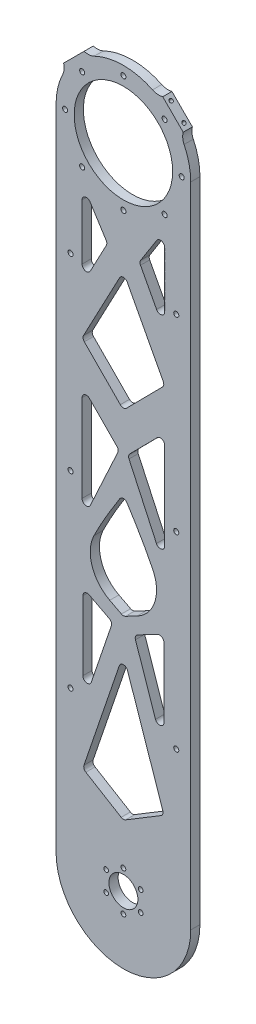
from build123d import *

# Parameters (mm, degrees)
SKETCH2_R                            = 10
SKETCH2_R_2                          = 1.65
BOSS_EXTRUDE1_DEPTH                  = 6.35
CUT_EXTRUDE1_DEPTH                   = 10
FILLET3_R                            = 3
SKETCH5_R                            = 1.75
CUT_EXTRUDE2_DEPTH                   = 549.511460792
SKETCH6_R                            = 26.5
CUT_EXTRUDE3_DEPTH                   = 10
BOSS_EXTRUDE2_START                  = -6.35
BOSS_EXTRUDE2_DEPTH                  = 6.35
TAP_DRILL_FOR_M3X0_5_TAP1_AT_2_COUNT = 2
TAP_DRILL_FOR_M3X0_5_TAP1_AT_2_PITCH = 12
CIRPATTERN2_COUNT                    = 2
CIRPATTERN2_ANGLE                    = 90
CUT_EXTRUDE4_DEPTH                   = 549.511460792
SKETCH11_R                           = 34
CUT_EXTRUDE5_DEPTH                   = 549.511460792
CUT_EXTRUDE6_DEPTH                   = 549.511460792
CUT_EXTRUDE6_DEPTH_BACK              = 549.511460792
SKETCH12_R                           = 1.75
SKETCH13_W                           = 93
SKETCH13_H                           = 53.952458561
CUT_EXTRUDE7_DEPTH                   = 549.511460792
BOSS_EXTRUDE3_REACH                  = 319.131
SKETCH14_W                           = 17.515975695
SKETCH14_H                           = 6.35
BOSS_EXTRUDE4_DEPTH                  = 6.35
SKETCH16_R                           = 1.75
CUT_EXTRUDE8_DEPTH                   = 497.007604239
SKETCH17_R                           = 1.75
BOSS_EXTRUDE5_DEPTH                  = 6.35
BOSS_EXTRUDE6_DEPTH                  = 6.35
M3X0_5_TAPPED_HOLE1_AT_2_COUNT       = 2
M3X0_5_TAPPED_HOLE1_AT_2_PITCH       = 12.5
CIRPATTERN3_COUNT                    = 2
CIRPATTERN3_ANGLE                    = 90
FILLET4_R                            = 10


with BuildPart() as part:
    # Sketch2 → Boss-Extrude1 (new body)
    with BuildSketch(Plane.XY):
        with BuildLine():
            Line((-46.5, 0), (-46.5, 500))
            ThreePointArc((-46.5, 500), (0, 546.5), (46.5, 500))
            Line((46.5, 500), (46.5, 0))
            ThreePointArc((46.5, 0), (0, -46.5), (-46.5, 0))
        make_face()
        Circle(SKETCH2_R, mode=Mode.SUBTRACT)
        with Locations((0, 13.75)):
            Circle(SKETCH2_R_2, mode=Mode.SUBTRACT)
        with Locations((11.907849302, 6.875)):
            Circle(SKETCH2_R_2, mode=Mode.SUBTRACT)
        with Locations((11.907849302, -6.875)):
            Circle(SKETCH2_R_2, mode=Mode.SUBTRACT)
        with Locations((0, -13.75)):
            Circle(SKETCH2_R_2, mode=Mode.SUBTRACT)
        with Locations((-11.907849302, -6.875)):
            Circle(SKETCH2_R_2, mode=Mode.SUBTRACT)
        with Locations((-11.907849302, 6.875)):
            Circle(SKETCH2_R_2, mode=Mode.SUBTRACT)
    extrude(amount=BOSS_EXTRUDE1_DEPTH)

    # Sketch4 → Cut-Extrude1 (cut)
    with BuildSketch(Plane.XY.offset(6.35)):
        Polygon((28.005258112, 59.37595418), (0, 42.411661153), (-28.005258112, 59.37595418), (0, 141.693437584), align=None)
        Polygon((-7.5, 156.905935087), (-28.005258112, 96.633637735), (-28.005258112, 167.582877854), align=None)
        Polygon((28.005258112, 167.582877854), (7.5, 156.905935087), (28.005258112, 96.633637735), align=None)
        with BuildLine():
            Line((0, 164.275138905), (28.550546746, 179.141206521))
            add(Edge.make_bspline(
                [(28.550546746, 179.141206521), (45.32025339, 216.985654627), (19.430092874, 259.790255689), (0, 290.025756679)],
                knots=[0, 0, 0, 0, 1, 1, 1, 1], degree=3))
            add(Edge.make_bspline(
                [(-28.550546746, 179.141206521), (-45.32025339, 216.985654627), (-19.430092874, 259.790255689), (0, 290.025756679)],
                knots=[0, 0, 0, 0, 1, 1, 1, 1], degree=3))
            Line((-28.550546746, 179.141206521), (0, 164.275138905))
        make_face()
        Polygon((28.550546746, 259.58677623), (3, 314.938284003), (28.550546746, 340.793051053), align=None)
        Polygon((-3, 314.938284003), (-28.550546746, 340.793051053), (-28.550546746, 259.58677623), align=None)
        Polygon((0, 423.142843498), (-28.550546746, 369.246205395), (0, 340.355718526), (28.550546746, 369.246205395), align=None)
        Polygon((-28.550546746, 462.095190817), (-28.550546746, 401.290241252), (-11, 434.421497018), align=None)
        Polygon((28.550546746, 401.290241252), (11, 434.421497018), (28.550546746, 462.095190817), align=None)
    extrude(amount=-CUT_EXTRUDE1_DEPTH, mode=Mode.SUBTRACT)

    # Fillet3
    fillet3_edges = [part.edges().sort_by_distance(p)[0] for p in [
        (-11, 434.421497018, 3.175),
        (-28.550546746, 401.290241252, 3.175),
        (28.550546746, 401.290241252, 3.175),
        (11, 434.421497018, 3.175),
        (28.550546746, 462.095190817, 3.175),
        (-28.550546746, 462.095190817, 3.175),
        (0, 423.142843498, 3.175),
        (-28.550546746, 369.246205395, 3.175),
        (28.550546746, 369.246205395, 3.175),
        (0, 340.355718526, 3.175),
        (28.550546746, 340.793051053, 3.175),
        (-28.550546746, 340.793051053, 3.175),
        (-3, 314.938284003, 3.175),
        (3, 314.938284003, 3.175),
        (28.550546746, 259.58677623, 3.175),
        (-28.550546746, 259.58677623, 3.175),
        (28.550546746, 179.141206521, 3.175),
        (0, 290.025756679, 3.175),
        (-28.550546746, 179.141206521, 3.175),
        (0, 164.275138905, 3.175),
        (-28.005258112, 96.633637735, 3.175),
        (28.005258112, 96.633637735, 3.175),
        (7.5, 156.905935087, 3.175),
        (-28.005258112, 167.582877854, 3.175),
        (28.005258112, 167.582877854, 3.175),
        (0, 141.693437584, 3.175),
        (28.005258112, 59.37595418, 3.175),
        (-28.005258112, 59.37595418, 3.175),
        (0, 42.411661153, 3.175),
        (-7.5, 156.905935087, 3.175),
    ]]
    fillet(fillet3_edges, radius=FILLET3_R)

    # Sketch5 → Cut-Extrude2 (cut, through all)
    with BuildSketch(Plane.XY.offset(6.35)):
        with Locations((36.5, 103.175)):
            Circle(SKETCH5_R)
        with Locations(Location((-36.5, 103.175, 0), (0, 0, 180))):
            Circle(SKETCH5_R)
        with Locations(Location((36.5, 259.525, 0), (0, 0, 180))):
            Circle(SKETCH5_R)
        with Locations((-36.5, 259.525)):
            Circle(SKETCH5_R)
        with Locations((36.5, 415.875)):
            Circle(SKETCH5_R)
        with Locations(Location((-36.5, 415.875, 0), (0, 0, 180))):
            Circle(SKETCH5_R)
    extrude(amount=-CUT_EXTRUDE2_DEPTH, mode=Mode.SUBTRACT)

    # Sketch6 → Cut-Extrude3 (cut)
    with BuildSketch(Plane.XY.offset(6.35)):
        with Locations((0, 500)):
            Circle(SKETCH6_R)
    extrude(amount=-CUT_EXTRUDE3_DEPTH, mode=Mode.SUBTRACT)

    # Sketch7 → Boss-Extrude2 (add)
    with BuildSketch(Plane.XY.offset(6.35).offset(BOSS_EXTRUDE2_START)):
        with BuildLine():
            Line((44.110383395, 529.968247771), (29.968247771, 544.110383395))
            ThreePointArc((29.968247771, 544.110383395), (23.286397782, 542.399293624), (16.474718596, 543.483717035))
            ThreePointArc((16.474718596, 543.483717035), (32.880465325, 532.880465325), (43.483717035, 516.474718596))
            ThreePointArc((43.483717035, 516.474718596), (42.399293624, 523.286397782), (44.110383395, 529.968247771))
        make_face()
    boss_extrude2 = extrude(amount=BOSS_EXTRUDE2_DEPTH)

    # Sketch9 → Tap Drill for M3x0.5 Tap1 (revolve, cut)
    with BuildSketch(Plane(origin=(32.796674896, 541.28195627, 3.175), x_dir=(-0.7071067811865481, 0.7071067811865469, 0), z_dir=(0, 0, 1))):
        Polygon((0, 0), (0, 5.751075774), (1.25, 5), (1.25, 0), align=None)
    tap_drill_for_m3x0_5_tap1 = revolve(axis=Axis((37.286802956, 545.772084331, 3.175), (-0.7071067811865468, -0.7071067811865482, 0)), mode=Mode.SUBTRACT)

    # Tap Drill for M3x0.5 Tap1 at 2: Tap Drill for M3x0.5 Tap1 ×2
    with Locations(*[Vector(0.7071067811865482, -0.7071067811865468, 0) * (i * TAP_DRILL_FOR_M3X0_5_TAP1_AT_2_PITCH) for i in range(1, TAP_DRILL_FOR_M3X0_5_TAP1_AT_2_COUNT)]):
        add(tap_drill_for_m3x0_5_tap1, mode=Mode.SUBTRACT)

    # CirPattern2: Boss-Extrude2, Tap Drill for M3x0.5 Tap1 ×2 about axis
    cirpattern2_axis = Axis((0, 500, 0), (0, 0, 1))
    add([boss_extrude2.rotate(cirpattern2_axis, i * CIRPATTERN2_ANGLE / (CIRPATTERN2_COUNT - 1)) for i in range(1, CIRPATTERN2_COUNT)])
    add([tap_drill_for_m3x0_5_tap1.rotate(cirpattern2_axis, i * CIRPATTERN2_ANGLE / (CIRPATTERN2_COUNT - 1)) for i in range(1, CIRPATTERN2_COUNT)], mode=Mode.SUBTRACT)

    # CirPattern2 copy 1 sketch → CirPattern2 copy 1 (revolve, cut)
    with BuildSketch(Plane(origin=(-32.796674896, 541.28195627, 3.175), x_dir=(-0.7071067811865445, -0.7071067811865506, 0), z_dir=(0, 0, 1))):
        Polygon((0, 0), (0, 5.751075774), (1.25, 5), (1.25, 0), align=None)
    revolve(axis=Axis((-37.286802956, 545.772084331, 3.175), (0.7071067811865507, -0.7071067811865444, 0)), mode=Mode.SUBTRACT)

    # Sketch10 → Cut-Extrude4 (cut, through all)
    with BuildSketch(Plane.XY.offset(6.35)):
        with BuildLine():
            Line((-43.483717035, 516.474718596), (-63.483717035, 516.474718596))
            ThreePointArc((-63.483717035, 516.474718596), (0, 565.586573942), (63.483717035, 516.474718596))
            Line((63.483717035, 516.474718596), (43.483717035, 516.474718596))
            ThreePointArc((43.483717035, 516.474718596), (0, 546.5), (-43.483717035, 516.474718596))
        make_face()
    extrude(amount=-CUT_EXTRUDE4_DEPTH, mode=Mode.SUBTRACT)

    # Sketch11 → Cut-Extrude5 (cut, through all)
    with BuildSketch(Plane.XY.offset(6.35)):
        with Locations((0, 500)):
            Circle(SKETCH11_R)
    extrude(amount=-CUT_EXTRUDE5_DEPTH, mode=Mode.SUBTRACT)

    # Sketch12 → Cut-Extrude6 (cut, two sides: drawn at the far end of the back side and taken through both)
    with BuildSketch(Plane.XY.offset(6.35).offset(-CUT_EXTRUDE6_DEPTH_BACK)):
        with Locations((0, 540.25)):
            Circle(SKETCH12_R)
        with Locations((28.461047943, 528.461047943)):
            Circle(SKETCH12_R)
        with Locations((40.25, 500)):
            Circle(SKETCH12_R)
        with Locations((28.461047943, 471.538952057)):
            Circle(SKETCH12_R)
        with Locations((0, 459.75)):
            Circle(SKETCH12_R)
        with Locations((-28.461047943, 471.538952057)):
            Circle(SKETCH12_R)
        with Locations((-40.25, 500)):
            Circle(SKETCH12_R)
        with Locations((-28.461047943, 528.461047943)):
            Circle(SKETCH12_R)
    extrude(amount=CUT_EXTRUDE6_DEPTH + CUT_EXTRUDE6_DEPTH_BACK, mode=Mode.SUBTRACT)

    # Sketch13 → Cut-Extrude7 (cut, through all)
    with BuildSketch(Plane(origin=(0, 0, 0), x_dir=(-1, 0, 0), z_dir=(0, 0, -1))):
        with Locations((0, 207.119171895)):
            Rectangle(SKETCH13_W, SKETCH13_H)
    extrude(amount=-CUT_EXTRUDE7_DEPTH, mode=Mode.SUBTRACT)


with BuildPart() as cut_extrude7_piece_1:
    # of the separate pieces the step leaves, piece 1, a body of its own (cut_extrude7_pieces)
    add(part.part.solids().sort_by_distance((46.5, 500, 0))[0])


with BuildPart() as cut_extrude7_piece_2:
    # of the separate pieces the step leaves, piece 2, a body of its own (cut_extrude7_pieces)
    add(part.part.solids().sort_by_distance((46.5, 180.142942614, 0))[0])


with BuildPart() as cut_extrude7_piece_1_1:
    # Body-Move/Copy1: moved
    add(cut_extrude7_piece_1.part.moved(Location((0, -52.7176888, 0))))

    # Boss-Extrude3: up to this face of the body (flat: up to its plane)
    boss_extrude3_end = Plane(cut_extrude7_piece_1_1.part.faces().sort_by_distance((37.742012152, 181.377712375, 3.175))[0])
    # Sketch14 → Boss-Extrude3 (add, up to the picked face)
    with BuildSketch(Plane(origin=(0, 180.142942614, 0), x_dir=(1, 0, 0), z_dir=(0, 1, 0)), mode=Mode.PRIVATE) as boss_extrude3_sk1:
        with Locations((-37.742012153, -3.175)):
            Rectangle(SKETCH14_W, SKETCH14_H)
    boss_extrude3_tool1 = split(extrude(boss_extrude3_sk1.sketch, amount=BOSS_EXTRUDE3_REACH, mode=Mode.PRIVATE), bisect_by=boss_extrude3_end, keep=Keep.BOTH, mode=Mode.PRIVATE)
    # Sketch14 → Boss-Extrude3 (add, up to the picked face)
    with BuildSketch(Plane(origin=(0, 180.142942614, 0), x_dir=(1, 0, 0), z_dir=(0, 1, 0)), mode=Mode.PRIVATE) as boss_extrude3_sk2:
        with Locations((37.742012153, -3.175)):
            Rectangle(SKETCH14_W, SKETCH14_H)
    boss_extrude3_tool2 = split(extrude(boss_extrude3_sk2.sketch, amount=BOSS_EXTRUDE3_REACH, mode=Mode.PRIVATE), bisect_by=boss_extrude3_end, keep=Keep.BOTH, mode=Mode.PRIVATE)

    add(cut_extrude7_piece_2.part)  # Boss-Extrude3 merges Cut-Extrude7 piece 2
    add(boss_extrude3_tool1.solids().sort_by(Axis((-37.742012, 180.142943, 3.175), (0, 1, 0)))[0])
    add(boss_extrude3_tool2.solids().sort_by(Axis((37.742012, 180.142943, 3.175), (0, 1, 0)))[0])

    # Sketch15 → Boss-Extrude4 (add)
    with BuildSketch(Plane(origin=(0, 0, 0), x_dir=(-1, 0, 0), z_dir=(0, 0, -1))):
        with BuildLine():
            Line((28.984024305, 181.377712375), (28.984024305, 180.142942614))
            ThreePointArc((28.984024305, 180.142942614), (28.425309599, 179.275911344), (27.605954054, 178.649363792))
            Line((27.605954054, 178.649363792), (9.43812576, 169.189504186))
            ThreePointArc((9.43812576, 169.189504186), (21.644913421, 183.565600372), (20.334408511, 202.379435266))
            add(Edge.make_bspline(
                [(28.984024305, 181.377712375), (26.665870811, 188.528361062), (23.678798122, 195.56600215), (20.334408511, 202.379435266)],
                knots=[0.471090389, 0.471090389, 0.471090389, 0.471090389, 0.656207947, 0.656207947, 0.656207947, 0.656207947], degree=3))
        make_face()
        with BuildLine():
            Line((-9.43812576, 169.189504186), (-27.605954054, 178.649363792))
            ThreePointArc((-27.605954054, 178.649363792), (-28.425309599, 179.275911344), (-28.984024305, 180.142942614))
            Line((-28.984024305, 180.142942614), (-28.984024304, 181.377712375))
            add(Edge.make_bspline(
                [(-28.984024304, 181.377712375), (-26.665870811, 188.528361062), (-23.678798122, 195.56600215), (-20.334408511, 202.379435266)],
                knots=[0.471090389, 0.471090389, 0.471090389, 0.471090389, 0.656207947, 0.656207947, 0.656207947, 0.656207947], degree=3))
            ThreePointArc((-20.334408511, 202.379435266), (-21.644913421, 183.565600372), (-9.43812576, 169.189504186))
        make_face()
    extrude(amount=-BOSS_EXTRUDE4_DEPTH)

    # Sketch16 → Cut-Extrude8 (cut, through all)
    with BuildSketch(Plane(origin=(0, 0, 0), x_dir=(-1, 0, 0), z_dir=(0, 0, -1))):
        with Locations((36.5, 233.1661556)):
            Circle(SKETCH16_R)
        with Locations((-36.5, 233.1661556)):
            Circle(SKETCH16_R)
    extrude(amount=-CUT_EXTRUDE8_DEPTH, mode=Mode.SUBTRACT)

    # Sketch17 → Boss-Extrude5 (add)
    with BuildSketch(Plane(origin=(0, 0, 0), x_dir=(-1, 0, 0), z_dir=(0, 0, -1))):
        with Locations((36.5, 206.8073112)):
            Circle(SKETCH17_R)
        with Locations((-36.5, 206.8073112)):
            Circle(SKETCH17_R)
    extrude(amount=-BOSS_EXTRUDE5_DEPTH)

    # Sketch18 → Boss-Extrude6 (add)
    with BuildSketch(Plane(origin=(0, 0, 0), x_dir=(-1, 0, 0), z_dir=(0, 0, -1))):
        Polygon((25.040067328, 486.464514152), (27.161387672, 488.585834496), (41.303523296, 474.443698872), (39.182202952, 472.322378528), align=None)
        Polygon((-39.182202952, 472.322378528), (-41.303523296, 474.443698872), (-27.161387672, 488.585834496), (-25.040067328, 486.464514152), align=None)
    extrude(amount=-BOSS_EXTRUDE6_DEPTH)

    # Sketch21 → M3x0.5 Tapped Hole1 (revolve, cut)
    with BuildSketch(Plane(origin=(-29.813038101, 485.934184066, 3.175), x_dir=(-0.707106781186547, -0.7071067811865481, 0), z_dir=(0, 0, 1))):
        Polygon((0, 0), (0, 8.251075774), (1.25, 7.5), (1.25, 0), align=None)
    m3x0_5_tapped_hole1 = revolve(axis=Axis((-34.303166162, 490.424312127, 3.175), (0.7071067811865481, -0.7071067811865469, 0)), mode=Mode.SUBTRACT)

    # M3x0.5 Tapped Hole1 at 2: M3x0.5 Tapped Hole1 ×2
    with Locations(*[Vector(-0.7071067811865469, -0.7071067811865481, 0) * (i * M3X0_5_TAPPED_HOLE1_AT_2_PITCH) for i in range(1, M3X0_5_TAPPED_HOLE1_AT_2_COUNT)]):
        add(m3x0_5_tapped_hole1, mode=Mode.SUBTRACT)

    # CirPattern3: M3x0.5 Tapped Hole1 ×2 about axis
    cirpattern3_axis = Axis((0, 447.2823112, 0), (0, 0, -1))
    for i in range(1, CIRPATTERN3_COUNT):
        add(m3x0_5_tapped_hole1.rotate(cirpattern3_axis, i * CIRPATTERN3_ANGLE / (CIRPATTERN3_COUNT - 1)), mode=Mode.SUBTRACT)

    # CirPattern3 copy 1 sketch → CirPattern3 copy 1 (revolve, cut)
    with BuildSketch(Plane(origin=(29.813038101, 485.934184066, 3.175), x_dir=(-0.7071067811865457, 0.7071067811865495, 0), z_dir=(0, 0, 1))):
        Polygon((0, 0), (0, 8.251075774), (1.25, 7.5), (1.25, 0), align=None)
    revolve(axis=Axis((34.303166162, 490.424312127, 3.175), (-0.7071067811865493, -0.7071067811865457, 0)), mode=Mode.SUBTRACT)

    # Fillet4
    # the kernel refuses this fillet: 10 mm, written as the material it adds along each edge
    with BuildSketch(Plane(origin=(-25.040067328, 486.464514152, 0), x_dir=(-0.7071067811865487, 0.7071067811865464, 0), z_dir=(0, 0, 1)), Plane(origin=(39.182202952, 472.322378528, 0), x_dir=(0.7071067811865666, 0.7071067811865286, 0), z_dir=(0, 0, 1))) as fillet4_piece_1:
        with BuildLine():
            CenterArc((7.897030706, -8.71889272), FILLET4_R, 119.321067137, 41.330757835)
            Line((-1.538196466, -5.405814363), (-1.72690101, -5.339552795))
            ThreePointArc((-1.72690101, -5.339552795), (-0.879713349, -2.671432223), (-0.195320442, 0.043010753))
            Line((-0.195320442, 0.043010753), (0, 0.2))
            ThreePointArc((0, 0.2), (1.5, 0.2), (2.902059386, 0.174377854))
            Line((2.902059386, 0.174377854), (3, 0))
        make_face()
    extrude(amount=6.35)
    with BuildSketch(Plane(origin=(-39.182202952, 472.322378528, 0), x_dir=(-0.486588082362211, -0.8736315230708346, 0), z_dir=(0, 0, 1)), Plane(origin=(25.040067328, 486.464514152, 0), x_dir=(-0.873631523070838, 0.4865880823622048, 0), z_dir=(0, 0, 1))) as fillet4_piece_2:
        with BuildLine():
            CenterArc((6.224742227, -9.981721717), FILLET4_R, 93.464746761, 41.330757835)
            Line((-0.821043125, -2.885461521), (-0.961958832, -2.743536317))
            ThreePointArc((-0.961958832, -2.743536317), (-0.602885664, -1.387994552), (-0.192364101, 0.054736208))
            Line((-0.192364101, 0.054736208), (0.012086878, 0.199634434))
            ThreePointArc((0.012086878, 0.199634434), (2.810199161, 0.115005986), (5.608311443, 0.199634434))
            Line((5.608311443, 0.199634434), (5.620398321, 0))
        make_face()
    extrude(amount=6.35)


solid = cut_extrude7_piece_1_1.part
